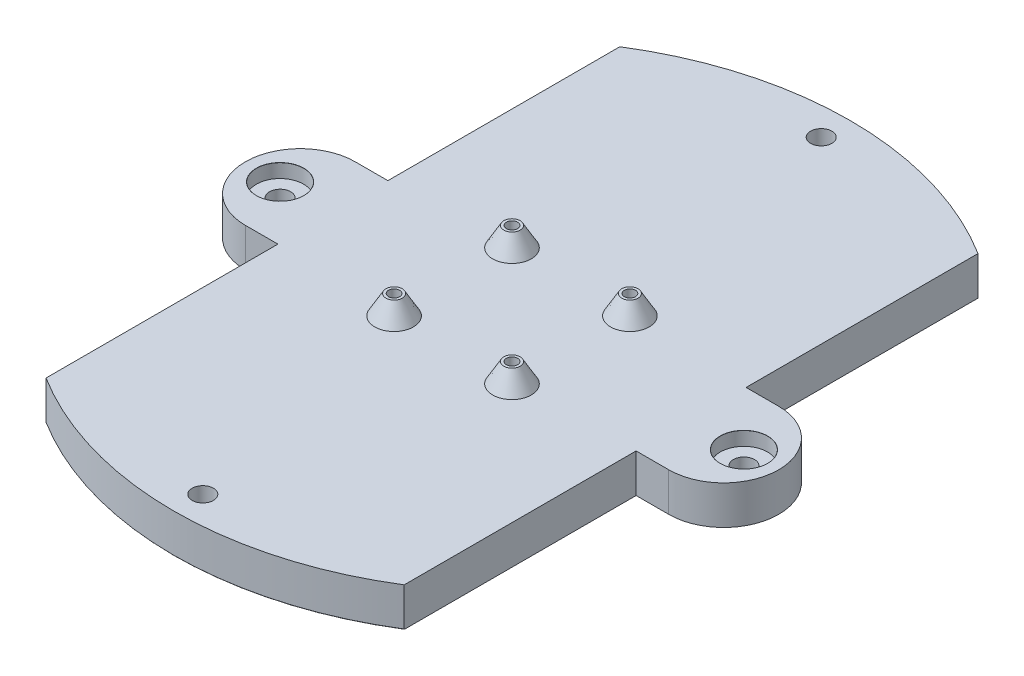
from build123d import *

# Parameters (mm, degrees)
SKETCH1_R                              = 87.5
BOSS_EXTRUDE1_DEPTH                    = 10
SKETCH2_R                              = 7.5
BOSS_EXTRUDE2_DEPTH                    = 80
CBORE_FOR_M5_HEX_HEAD_BOLT1_AT_2_COUNT = 2
CBORE_FOR_M5_HEX_HEAD_BOLT1_AT_2_PITCH = 113.13708499
CBORE_FOR_M5_HEX_HEAD_BOLT1_AT_3_COUNT = 2
CBORE_FOR_M5_HEX_HEAD_BOLT1_AT_3_PITCH = 160
CBORE_FOR_M5_HEX_HEAD_BOLT1_AT_4_COUNT = 2
CBORE_FOR_M5_HEX_HEAD_BOLT1_AT_4_PITCH = 113.13708499
SKETCH5_R                              = 87.5
CUT_EXTRUDE1_DEPTH                     = 80
FILLET1_R                              = 0.1
SKETCH6_R                              = 5
BOSS_EXTRUDE3_DEPTH                    = 5
BOSS_EXTRUDE3_DRAFT                    = 30
BOSS_EXTRUDE3_PROFILE_2_DEPTH          = 5
BOSS_EXTRUDE3_PROFILE_2_DRAFT          = 30
BOSS_EXTRUDE3_PROFILE_3_DEPTH          = 5
BOSS_EXTRUDE3_PROFILE_3_DRAFT          = 30
BOSS_EXTRUDE3_PROFILE_4_DEPTH          = 5
BOSS_EXTRUDE3_PROFILE_4_DRAFT          = 30
SKETCH7_R                              = 1.45
CUT_EXTRUDE2_DEPTH                     = 8
CUT_EXTRUDE5_DEPTH                     = 10
CBORE_FOR_M5_HEX_HEAD_BOLT2_AT_2_COUNT = 2
CBORE_FOR_M5_HEX_HEAD_BOLT2_AT_2_PITCH = 120
SKETCH14_R                             = 2.75
CUT_EXTRUDE6_DEPTH                     = 70
FILLET2_RADIUS                         = 14.224079762
FILLET2_LENGTH                         = 10
FILLET3_RADIUS                         = 14.224079762
FILLET3_LENGTH                         = 10


with BuildPart() as part:
    # Sketch1 → Boss-Extrude1 (new body)
    with BuildSketch(Plane(origin=(0, 0, 0), x_dir=(1, 0, 0), z_dir=(0, 1, 0))):
        with Locations(Location((0, 0, 0), (0, 0, 270))):
            Circle(SKETCH1_R)
    extrude(amount=BOSS_EXTRUDE1_DEPTH)

    # Sketch2 → Boss-Extrude2 (add)
    with BuildSketch(Plane(origin=(0, 10, 0), x_dir=(1, 0, 0), z_dir=(0, 1, 0))):
        with Locations(Location((0, -80, 0), (0, 0, 269.999690569))):
            Circle(SKETCH2_R)
        with Locations(Location((-80, 0, 0), (0, 0, 179.999690555))):
            Circle(SKETCH2_R)
        with Locations(Location((0, 80, 0), (0, 0, 89.999690569))):
            Circle(SKETCH2_R)
        with Locations(Location((80, 0, 0), (0, 0, 359.999690555))):
            Circle(SKETCH2_R)
    extrude(amount=BOSS_EXTRUDE2_DEPTH)

    # Sketch4 → CBORE for M5 Hex Head Bolt1 (revolve, cut)
    with BuildSketch(Plane(origin=(80, 0, 0), x_dir=(0, 0, -1), z_dir=(1, 0, 0))):
        Polygon((0, 0), (0, 21.652366702), (2.75, 20), (2.75, 3.58), (6.12, 3.58), (6.12, 0.025), (6.145, 0), align=None)
    cbore_for_m5_hex_head_bolt1 = revolve(axis=Axis((80, -6.35, 0), (0, 1, 0)), mode=Mode.SUBTRACT)

    # CBORE for M5 Hex Head Bolt1 at 2: CBORE for M5 Hex Head Bolt1 ×2
    with Locations(*[Vector(-0.7071067811865476, 0, -0.7071067811865476) * (i * CBORE_FOR_M5_HEX_HEAD_BOLT1_AT_2_PITCH) for i in range(1, CBORE_FOR_M5_HEX_HEAD_BOLT1_AT_2_COUNT)]):
        add(cbore_for_m5_hex_head_bolt1, mode=Mode.SUBTRACT)

    # CBORE for M5 Hex Head Bolt1 at 3: CBORE for M5 Hex Head Bolt1 ×2
    with Locations(*[(-i * CBORE_FOR_M5_HEX_HEAD_BOLT1_AT_3_PITCH, 0, 0) for i in range(1, CBORE_FOR_M5_HEX_HEAD_BOLT1_AT_3_COUNT)]):
        add(cbore_for_m5_hex_head_bolt1, mode=Mode.SUBTRACT)

    # CBORE for M5 Hex Head Bolt1 at 4: CBORE for M5 Hex Head Bolt1 ×2
    with Locations(*[Vector(-0.7071067811865476, 0, 0.7071067811865476) * (i * CBORE_FOR_M5_HEX_HEAD_BOLT1_AT_4_PITCH) for i in range(1, CBORE_FOR_M5_HEX_HEAD_BOLT1_AT_4_COUNT)]):
        add(cbore_for_m5_hex_head_bolt1, mode=Mode.SUBTRACT)

    # Sketch5 → Cut-Extrude1 (cut)
    with BuildSketch(Plane(origin=(0, 10, 0), x_dir=(1, 0, 0), z_dir=(0, 1, 0))):
        with Locations(Location((0, 0, 0), (0, 0, 270))):
            Circle(SKETCH5_R)
    extrude(amount=CUT_EXTRUDE1_DEPTH, mode=Mode.SUBTRACT)


with BuildPart() as cut_extrude1_kept_piece:
    # of the separate pieces the step leaves, the one the design keeps (cut_extrude1_pieces_kept)
    add(part.part.solids().sort_by_distance((0, 0, 87.5))[0])

    # Fillet1
    fillet1_2_edges = [cut_extrude1_kept_piece.edges().sort_by_distance(p)[0] for p in [
        (0, 0, -87.5),
    ]]
    fillet(fillet1_2_edges, radius=FILLET1_R)


with BuildPart() as boss_extrude3_tool:
    # Sketch6 → Boss-Extrude3 (with draft: the straight prism first)
    with BuildSketch(Plane(origin=(0, 10, 0), x_dir=(1, 0, 0), z_dir=(0, 1, 0))):
        with Locations((-15.25, 15.25)):
            Circle(SKETCH6_R)
    extrude(amount=BOSS_EXTRUDE3_DEPTH)
    # Boss-Extrude3: the draft: its side faces are tilted about the plane it starts from
    boss_extrude3_sides = [boss_extrude3_tool.faces().sort_by_distance(p)[0] for p in [
        (-20.25, 12.5, -15.25),
    ]]
    draft(boss_extrude3_sides, Plane(origin=(0, 10, 0), x_dir=(1, 0, 0), z_dir=(0, 1, 0)), BOSS_EXTRUDE3_DRAFT)


with BuildPart() as cut_extrude1_kept_piece_1:
    add(cut_extrude1_kept_piece.part)

    # Boss-Extrude3: add boss_extrude3_tool
    add(boss_extrude3_tool.part)


with BuildPart() as boss_extrude3_profile_2_tool:
    # Sketch6 → Boss-Extrude3 profile 2 (with draft: the straight prism first)
    with BuildSketch(Plane(origin=(0, 10, 0), x_dir=(1, 0, 0), z_dir=(0, 1, 0))):
        with Locations((15.25, 15.25)):
            Circle(SKETCH6_R)
    extrude(amount=BOSS_EXTRUDE3_PROFILE_2_DEPTH)
    # Boss-Extrude3 profile 2: the draft: its side faces are tilted about the plane it starts from
    boss_extrude3_profile_2_sides = [boss_extrude3_profile_2_tool.faces().sort_by_distance(p)[0] for p in [
        (10.25, 12.5, -15.25),
    ]]
    draft(boss_extrude3_profile_2_sides, Plane(origin=(0, 10, 0), x_dir=(1, 0, 0), z_dir=(0, 1, 0)), BOSS_EXTRUDE3_PROFILE_2_DRAFT)


with BuildPart() as cut_extrude1_kept_piece_2:
    add(cut_extrude1_kept_piece_1.part)

    # Boss-Extrude3 profile 2: add boss_extrude3_profile_2_tool
    add(boss_extrude3_profile_2_tool.part)


with BuildPart() as boss_extrude3_profile_3_tool:
    # Sketch6 → Boss-Extrude3 profile 3 (with draft: the straight prism first)
    with BuildSketch(Plane(origin=(0, 10, 0), x_dir=(1, 0, 0), z_dir=(0, 1, 0))):
        with Locations((15.25, -15.25)):
            Circle(SKETCH6_R)
    extrude(amount=BOSS_EXTRUDE3_PROFILE_3_DEPTH)
    # Boss-Extrude3 profile 3: the draft: its side faces are tilted about the plane it starts from
    boss_extrude3_profile_3_sides = [boss_extrude3_profile_3_tool.faces().sort_by_distance(p)[0] for p in [
        (10.25, 12.5, 15.25),
    ]]
    draft(boss_extrude3_profile_3_sides, Plane(origin=(0, 10, 0), x_dir=(1, 0, 0), z_dir=(0, 1, 0)), BOSS_EXTRUDE3_PROFILE_3_DRAFT)


with BuildPart() as cut_extrude1_kept_piece_3:
    add(cut_extrude1_kept_piece_2.part)

    # Boss-Extrude3 profile 3: add boss_extrude3_profile_3_tool
    add(boss_extrude3_profile_3_tool.part)


with BuildPart() as boss_extrude3_profile_4_tool:
    # Sketch6 → Boss-Extrude3 profile 4 (with draft: the straight prism first)
    with BuildSketch(Plane(origin=(0, 10, 0), x_dir=(1, 0, 0), z_dir=(0, 1, 0))):
        with Locations((-15.25, -15.25)):
            Circle(SKETCH6_R)
    extrude(amount=BOSS_EXTRUDE3_PROFILE_4_DEPTH)
    # Boss-Extrude3 profile 4: the draft: its side faces are tilted about the plane it starts from
    boss_extrude3_profile_4_sides = [boss_extrude3_profile_4_tool.faces().sort_by_distance(p)[0] for p in [
        (-20.25, 12.5, 15.25),
    ]]
    draft(boss_extrude3_profile_4_sides, Plane(origin=(0, 10, 0), x_dir=(1, 0, 0), z_dir=(0, 1, 0)), BOSS_EXTRUDE3_PROFILE_4_DRAFT)


with BuildPart() as cut_extrude1_kept_piece_4:
    add(cut_extrude1_kept_piece_3.part)

    # Boss-Extrude3 profile 4: add boss_extrude3_profile_4_tool
    add(boss_extrude3_profile_4_tool.part)

    # Sketch7 → Cut-Extrude2 (cut)
    with BuildSketch(Plane(origin=(0, 15, 0), x_dir=(1, 0, 0), z_dir=(0, 1, 0))):
        with Locations(Location((-15.25, 15.25, 0), (0, 0, 270))):
            Circle(SKETCH7_R)
        with Locations(Location((15.25, 15.25, 0), (0, 0, 270))):
            Circle(SKETCH7_R)
        with Locations(Location((15.25, -15.25, 0), (0, 0, 270))):
            Circle(SKETCH7_R)
        with Locations(Location((-15.25, -15.25, 0), (0, 0, 270))):
            Circle(SKETCH7_R)
    extrude(amount=-CUT_EXTRUDE2_DEPTH, mode=Mode.SUBTRACT)

    # Sketch10 → Cut-Extrude5 (cut)
    with BuildSketch(Plane.XZ):
        with BuildLine():
            Line((-86.336119643, -14.224079762), (-46.336119643, -14.224079762))
            Line((-46.336119643, -14.224079762), (-46.336119643, -74.224079762))
            ThreePointArc((-46.336119643, -74.224079762), (-72.804400755, -48.53626717), (-86.336119643, -14.224079762))
        make_face()
        with BuildLine():
            Line((-46.336119643, 14.224079762), (-46.336119643, 74.224079762))
            ThreePointArc((-46.336119643, 74.224079762), (-72.804400755, 48.53626717), (-86.336119643, 14.224079762))
            Line((-86.336119643, 14.224079762), (-46.336119643, 14.224079762))
        make_face()
        with BuildLine():
            Line((46.336119643, 14.224079762), (86.336119643, 14.224079762))
            ThreePointArc((86.336119643, 14.224079762), (72.804400755, 48.53626717), (46.336119643, 74.224079762))
            Line((46.336119643, 74.224079762), (46.336119643, 14.224079762))
        make_face()
        with BuildLine():
            Line((46.336119643, -14.224079762), (46.336119643, -74.224079762))
            ThreePointArc((46.336119643, -74.224079762), (72.804400755, -48.53626717), (86.336119643, -14.224079762))
            Line((86.336119643, -14.224079762), (46.336119643, -14.224079762))
        make_face()
    extrude(amount=-CUT_EXTRUDE5_DEPTH, mode=Mode.SUBTRACT)

    # Sketch13 → CBORE for M5 Hex Head Bolt2 (revolve, cut)
    with BuildSketch(Plane(origin=(-60, 10, 0), x_dir=(0, 0, 1), z_dir=(1, 0, 0))):
        Polygon((0, 0), (0, 10), (2.75, 10), (2.75, 3.58), (6.12, 3.58), (6.12, 0.025), (6.145, 0), align=None)
    cbore_for_m5_hex_head_bolt2 = revolve(axis=Axis((-60, 16.35, 0), (0, -1, 0)), mode=Mode.SUBTRACT)

    # CBORE for M5 Hex Head Bolt2 at 2: CBORE for M5 Hex Head Bolt2 ×2
    with Locations(*[(i * CBORE_FOR_M5_HEX_HEAD_BOLT2_AT_2_PITCH, 0, 0) for i in range(1, CBORE_FOR_M5_HEX_HEAD_BOLT2_AT_2_COUNT)]):
        add(cbore_for_m5_hex_head_bolt2, mode=Mode.SUBTRACT)

    # Sketch14 → Cut-Extrude6 (cut)
    # profile 1 of 2: a face of its own
    with BuildSketch(Plane(origin=(0, 10, 0), x_dir=(1, 0, 0), z_dir=(0, 1, 0))):
        with BuildLine():
            Line((-69, -14.224079762), (-69, 14.224079762))
            Line((-69, 14.224079762), (-86.336119643, 14.224079762))
            ThreePointArc((-86.336119643, 14.224079762), (-87.5, 0), (-86.336119643, -14.224079762))
            Line((-86.336119643, -14.224079762), (-69, -14.224079762))
        make_face()
        with Locations((-80, 0)):
            Circle(SKETCH14_R, mode=Mode.SUBTRACT)
    # profile 2 of 2: a face of its own
    with BuildSketch(Plane(origin=(0, 10, 0), x_dir=(1, 0, 0), z_dir=(0, 1, 0))):
        with BuildLine():
            Line((86.336119643, 14.224079762), (69, 14.224079762))
            Line((69, 14.224079762), (69, -14.224079762))
            Line((69, -14.224079762), (86.336119643, -14.224079762))
            ThreePointArc((86.336119643, -14.224079762), (87.5, 0), (86.336119643, 14.224079762))
        make_face()
        with Locations((80, 0)):
            Circle(SKETCH14_R, mode=Mode.SUBTRACT)
    extrude(amount=-CUT_EXTRUDE6_DEPTH, mode=Mode.SUBTRACT)

    # Fillet2: full round fillet: the end face becomes a half cylinder, R = half its width
    fillet2_face = Plane((-69, 5, 0), x_dir=(0, 1, 0), z_dir=(-1, 0, 0))  # on the end face: x along it, z out of the body
    fillet2_slab = fillet2_face.offset(-FILLET2_RADIUS / 2) * Box(FILLET2_LENGTH, 2 * FILLET2_RADIUS, FILLET2_RADIUS, mode=Mode.PRIVATE)  # the body's end, R deep
    fillet2_round = Plane((-54.775920238, 5, 0), x_dir=(-1, 0, 0), z_dir=(0, 1, 0)) * Cylinder(FILLET2_RADIUS, FILLET2_LENGTH, mode=Mode.PRIVATE)  # its axis R under the face
    add(fillet2_slab - fillet2_round, mode=Mode.SUBTRACT)

    # Fillet3: full round fillet: the end face becomes a half cylinder, R = half its width
    fillet3_face = Plane((69, 5, 0), x_dir=(0, 1, 0), z_dir=(1, 0, 0))  # on the end face: x along it, z out of the body
    fillet3_slab = fillet3_face.offset(-FILLET3_RADIUS / 2) * Box(FILLET3_LENGTH, 2 * FILLET3_RADIUS, FILLET3_RADIUS, mode=Mode.PRIVATE)  # the body's end, R deep
    fillet3_round = Plane((54.775920238, 5, 0), x_dir=(1, 0, 0), z_dir=(0, 1, 0)) * Cylinder(FILLET3_RADIUS, FILLET3_LENGTH, mode=Mode.PRIVATE)  # its axis R under the face
    add(fillet3_slab - fillet3_round, mode=Mode.SUBTRACT)


solid = cut_extrude1_kept_piece_4.part
